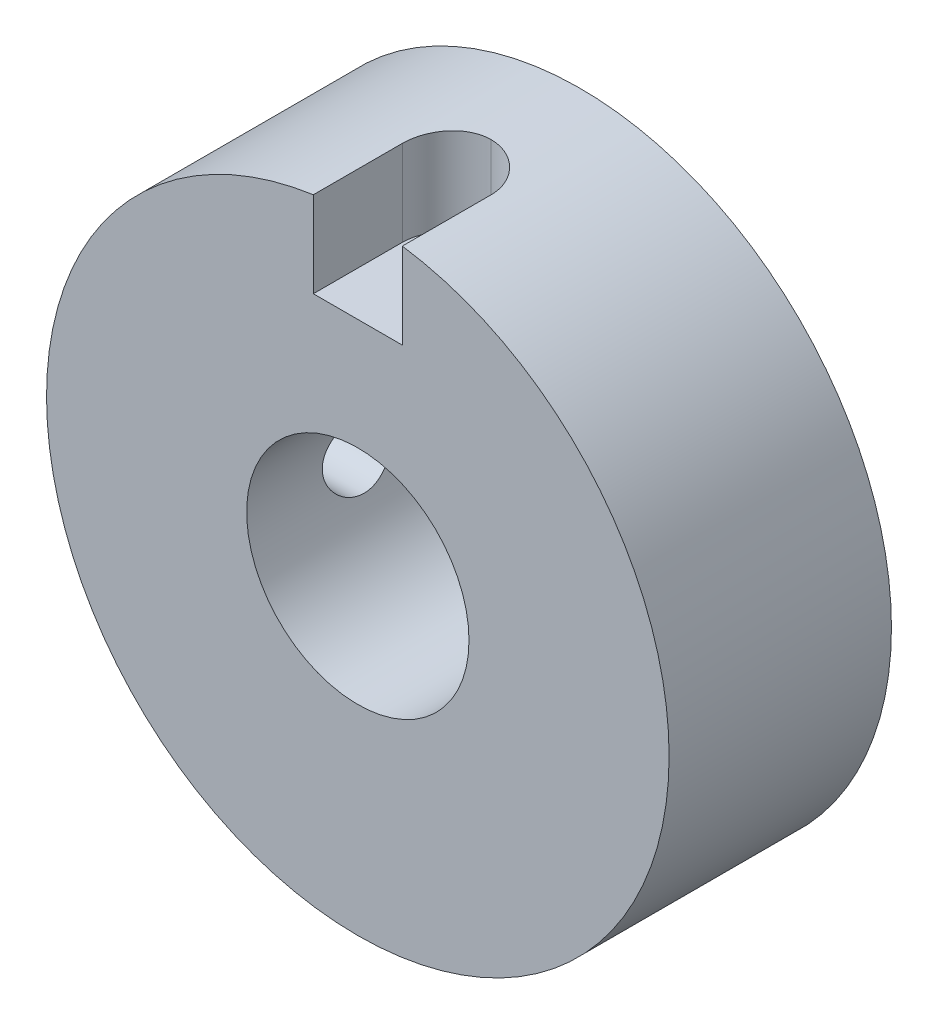
from build123d import *

# Parameters (mm, degrees)
SKETCH1_R          = 35
EXTRUDE1_DEPTH     = 25
SKETCH2_R          = 12.5
CUT_EXTRUDE1_DEPTH = 56.452682532
SKETCH3_W          = 10
SKETCH3_H          = 15.734862576
CUT_EXTRUDE2_DEPTH = 15
FILLET1_R          = 5
SKETCH4_R          = 22.5
CUT_EXTRUDE4_DEPTH = 5
SKETCH5_R          = 4
SIDE_HOLE_DEPTH    = 56.452682595


with BuildPart() as part:
    # Sketch1 → Extrude1 (new body)
    with BuildSketch(Plane.XY):
        Circle(SKETCH1_R)
    extrude(amount=EXTRUDE1_DEPTH)

    # Sketch2 → Cut-Extrude1 (cut, through all)
    with BuildSketch(Plane.XY.offset(25)):
        Circle(SKETCH2_R)
    extrude(amount=-CUT_EXTRUDE1_DEPTH, mode=Mode.SUBTRACT)

    # Sketch3 → Cut-Extrude2 (cut)
    with BuildSketch(Plane.XY.offset(25)):
        with Locations((0, 32.867431288)):
            Rectangle(SKETCH3_W, SKETCH3_H)
    extrude(amount=-CUT_EXTRUDE2_DEPTH, mode=Mode.SUBTRACT)

    # Fillet1
    # the kernel refuses this fillet: 5 mm, written as the material it adds along each edge
    with BuildSketch(Plane(origin=(-5, 12.5, 10), x_dir=(0, 0, 1), z_dir=(0, 1, 0))) as fillet1_piece_1_section:
        with BuildLine():
            CenterArc((FILLET1_R, FILLET1_R), FILLET1_R, 180, 90)
            Line((0, FILLET1_R), (0, 0))
            Line((0, 0), (FILLET1_R, 0))
        make_face()
    fillet1_piece_1 = extrude(amount=34.641016151, mode=Mode.PRIVATE)
    fillet1_piece_1 = fillet1_piece_1 & Plane(origin=(0, 0, 10), x_dir=(1, 0, 0), z_dir=(0, 0, -1)) * Cylinder(35, 90, mode=Mode.PRIVATE)
    with BuildSketch(Plane(origin=(5, 47.141016151, 10), x_dir=(-1, 0, 0), z_dir=(0, -1, 0))) as fillet1_piece_2_section:
        with BuildLine():
            CenterArc((FILLET1_R, -FILLET1_R), FILLET1_R, 90, 90)
            Line((0, -FILLET1_R), (0, 0))
            Line((0, 0), (FILLET1_R, 0))
        make_face()
    fillet1_piece_2 = extrude(amount=34.641016151, mode=Mode.PRIVATE)
    fillet1_piece_2 = fillet1_piece_2 & Plane(origin=(0, 0, 10), x_dir=(1, 0, 0), z_dir=(0, 0, -1)) * Cylinder(35, 90, mode=Mode.PRIVATE)
    add([fillet1_piece_1, fillet1_piece_2])

    # Sketch4 → Cut-Extrude4 (cut)
    with BuildSketch(Plane(origin=(0, 0, 0), x_dir=(-1, 0, 0), z_dir=(0, 0, -1))):
        Circle(SKETCH4_R)
    extrude(amount=-CUT_EXTRUDE4_DEPTH, mode=Mode.SUBTRACT)

    # Sketch5 → Side hole (cut, through all)
    with BuildSketch(Plane(origin=(0, 0, 0), x_dir=(0, 0, -1), z_dir=(1, 0, 0))):
        with Locations((-12.5, -0.089745962)):
            Circle(SKETCH5_R)
    extrude(amount=-SIDE_HOLE_DEPTH, mode=Mode.SUBTRACT)


solid = part.part
